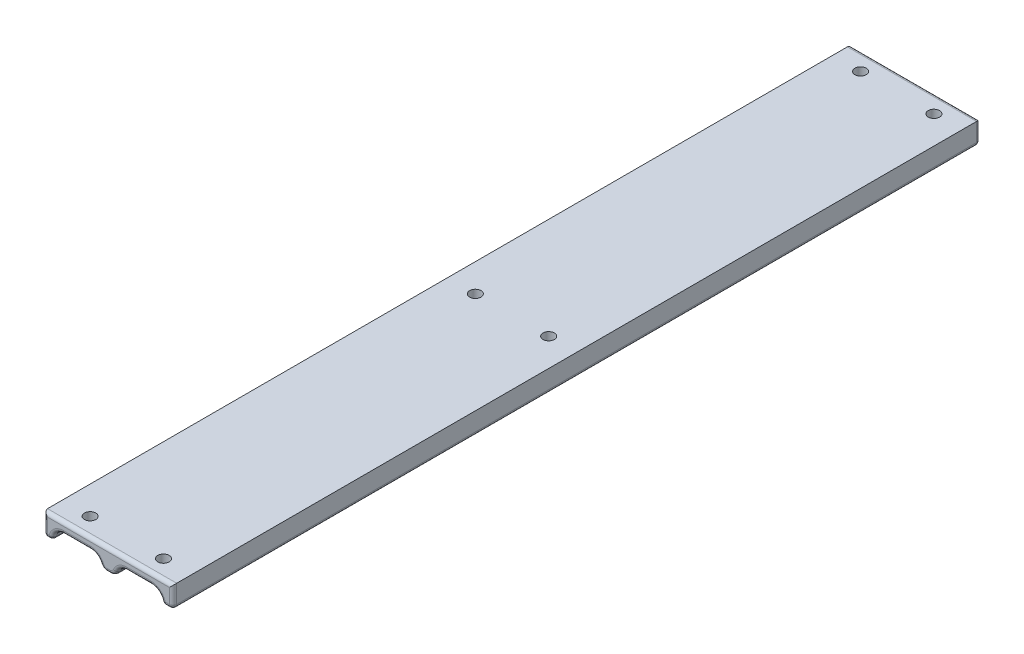
from build123d import *

# Parameters (mm, degrees)
SKETCH_1_W      = 35.208152802
SKETCH_1_H      = 220
SKETCH_1_R      = 1.55
EXTRUDE_1_DEPTH = 3
SKETCH_2_W      = 3
SKETCH_2_H      = 220
SKETCH_2_W_2    = 2
SKETCH_2_W_3    = 2.345683745
EXTRUDE_2_DEPTH = 3
FILLET_1_R      = 3
FILLET_2_R      = 2
FILLET_3_R      = 1


with BuildPart() as part:
    # 草图1 → 凸台-拉伸1 (new body)
    with BuildSketch(Plane(origin=(0, 0, 0), x_dir=(1, 0, 0), z_dir=(0, 1, 0))):
        Rectangle(SKETCH_1_W, SKETCH_1_H)
        with Locations(Location((10, -105, 0), (0, 0, 270))):
            Circle(SKETCH_1_R, mode=Mode.SUBTRACT)
        with Locations(Location((-10, -105, 0), (0, 0, 270))):
            Circle(SKETCH_1_R, mode=Mode.SUBTRACT)
        with Locations(Location((10, 0, 0), (0, 0, 270))):
            Circle(SKETCH_1_R, mode=Mode.SUBTRACT)
        with Locations(Location((-10, 0, 0), (0, 0, 270))):
            Circle(SKETCH_1_R, mode=Mode.SUBTRACT)
        with Locations(Location((10, 105, 0), (0, 0, 270))):
            Circle(SKETCH_1_R, mode=Mode.SUBTRACT)
        with Locations(Location((-10, 105, 0), (0, 0, 270))):
            Circle(SKETCH_1_R, mode=Mode.SUBTRACT)
    extrude(amount=EXTRUDE_1_DEPTH)

    # 草图2 → 凸台-拉伸2 (add)
    with BuildSketch(Plane.XZ):
        with Locations((16.104076401, 0)):
            Rectangle(SKETCH_2_W, SKETCH_2_H)
        with Locations((-1, 0)):
            Rectangle(SKETCH_2_W_2, SKETCH_2_H)
        with Locations((1, 0)):
            Rectangle(SKETCH_2_W_2, SKETCH_2_H)
        with Locations((-16.431234528, 0)):
            Rectangle(SKETCH_2_W_3, SKETCH_2_H)
    extrude(amount=EXTRUDE_2_DEPTH)

    # 圆角1
    fillet_1_edges = [part.edges().sort_by_distance(p)[0] for p in [
        (14.604076401, 0, 0),
        (2, 0, 0),
        (-2, 0, 0),
        (-15.258392656, 0, 0),
    ]]
    fillet(fillet_1_edges, radius=FILLET_1_R - 0.0001)  # a hair under: the kernel refuses the full size

    # 圆角2
    fillet_2_edges = [part.edges().sort_by_distance(p)[0] for p in [
        (-2, -3, 0),
        (2, -3, 0),
    ]]
    fillet(fillet_2_edges, radius=FILLET_2_R)

    # 圆角3
    fillet_3_edges = [part.edges().sort_by_distance(p)[0] for p in [
        (-3.356770668, -0.490014343, -110),
        (0, -3, 110),
        (3.356770668, -0.490014343, 110),
        (1.512845841, -2.673312882, 110),
        (-1.512845841, -2.673312882, 110),
        (0, -3, -110),
        (1.512845841, -2.673312882, -110),
        (-1.512845841, -2.673312882, -110),
        (0, 3, -110),
        (16.104076401, -3, 110),
        (14.604076401, -3, 0),
        (16.104076401, -3, -110),
        (17.604076401, -3, 0),
        (-15.258392656, -3, 0),
        (-16.431234528, -3, 110),
        (-17.604076401, -3, 0),
        (-16.431234528, -3, -110),
        (-17.604076401, 0, -110),
        (17.604076401, 0, -110),
        (17.604076401, 0, 110),
        (-17.604076401, 0, 110),
        (8.3020382, 0, -110),
        (8.3020382, 0, 110),
        (-8.629196328, 0, 110),
        (-8.629196328, 0, -110),
        (13.725426034, -0.878650367, -110),
        (13.725426034, -0.878650367, 110),
        (0, 3, 110),
        (3.356770668, -0.490014343, -110),
        (-3.356770668, -0.490014343, 110),
        (-14.379742289, -0.878650367, -110),
        (-14.379742289, -0.878650367, 110),
    ]]
    fillet(fillet_3_edges, radius=FILLET_3_R)


solid = part.part
